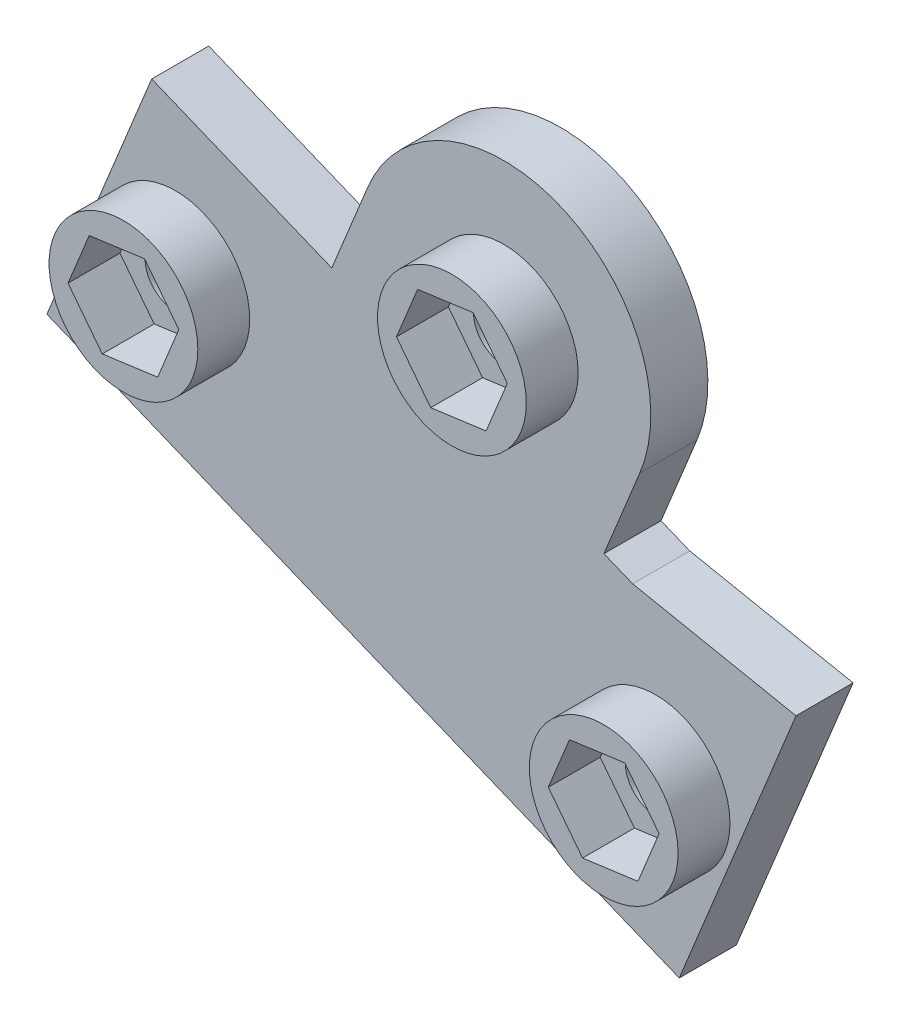
from build123d import *
from build123d.topology import SkipClean

# Parameters (mm, degrees)
SKETCH1_R           = 1.75
BOSS_EXTRUDE1_DEPTH = 3.3
BOSS_EXTRUDE2_START = 0.2
SKETCH2_R           = 4.1
SKETCH2_R_2         = 1.75
BOSS_EXTRUDE2_DEPTH = 0.2
SKETCH3_R           = 4.3
BOSS_EXTRUDE3_DEPTH = 3


with BuildPart() as part:
    # Sketch1 → Boss-Extrude1 (new body)
    with BuildSketch(Plane.XY):
        with BuildLine():
            Line((-67.867206803, -11.146761798), (-69.943886559, -16.223349695))
            Line((-69.943886559, -16.223349695), (-80.356366151, -11.963916781))
            Line((-80.356366151, -11.963916781), (-86.414226296, -26.772776645))
            Line((-86.414226296, -26.772776645), (-49.854853507, -41.728118878))
            Line((-49.854853507, -41.728118878), (-43.103796568, -25.224691306))
            Line((-43.103796568, -25.224691306), (-52.547252782, -23.339790487))
            Line((-52.547252782, -23.339790487), (-54.209472954, -22.659826099))
            Line((-54.209472954, -22.659826099), (-52.132793197, -17.583238202))
            ThreePointArc((-52.132793197, -17.583238202), (-56.781761798, -6.497793197), (-67.867206803, -11.146761798))
        make_face()
        with Locations((-60, -14.365)):
            Circle(SKETCH1_R, mode=Mode.SUBTRACT)
        with Locations((-78.988915951, -21.166773943)):
            Circle(SKETCH1_R, mode=Mode.SUBTRACT)
        with Locations((-51.222303707, -32.525261715)):
            Circle(SKETCH1_R, mode=Mode.SUBTRACT)
    extrude(amount=BOSS_EXTRUDE1_DEPTH)

    # Sketch2 → Boss-Extrude2 (add)
    with SkipClean():  # the faces are left unmerged after this step: merging them gives an invalid solid
        with BuildSketch(Plane(origin=(0, 0, 0), x_dir=(-1, 0, 0), z_dir=(0, 0, -1)).offset(BOSS_EXTRUDE2_START)):
            with Locations((60, -14.365)):
                Circle(SKETCH2_R)
            with Locations((60, -14.365)):
                Circle(SKETCH2_R_2, mode=Mode.SUBTRACT)
        extrude(amount=-BOSS_EXTRUDE2_DEPTH)

    # Sketch3 → Boss-Extrude3 (add)
    # profile 1 of 3: a face of its own
    with BuildSketch(Plane.XY.offset(3.3)):
        with Locations((-78.988915951, -21.166773943)):
            Circle(SKETCH3_R)
        Polygon((-80.96840267, -18.610416053), (-77.764788436, -18.174309213), (-75.785301718, -20.730667104), (-77.009429233, -23.723131834), (-80.213043466, -24.159238673), (-82.192530185, -21.602880783), align=None, mode=Mode.SUBTRACT)
    # profile 2 of 3: a face of its own
    with BuildSketch(Plane.XY.offset(3.3)):
        with Locations((-60, -14.365)):
            Circle(SKETCH3_R)
        Polygon((-58.020513281, -16.92135789), (-61.224127515, -17.35746473), (-63.203614234, -14.80110684), (-61.979486719, -11.80864211), (-58.775872485, -11.37253527), (-56.796385766, -13.92889316), align=None, mode=Mode.SUBTRACT)
    # profile 3 of 3: a face of its own
    with BuildSketch(Plane.XY.offset(3.3)):
        with Locations((-51.222303707, -32.525261715)):
            Circle(SKETCH3_R)
        Polygon((-49.242816988, -35.081619606), (-52.446431222, -35.517726445), (-54.42591794, -32.961368555), (-53.201790425, -29.968903825), (-49.998176192, -29.532796985), (-48.018689473, -32.089154876), align=None, mode=Mode.SUBTRACT)
    extrude(amount=BOSS_EXTRUDE3_DEPTH)


solid = part.part
